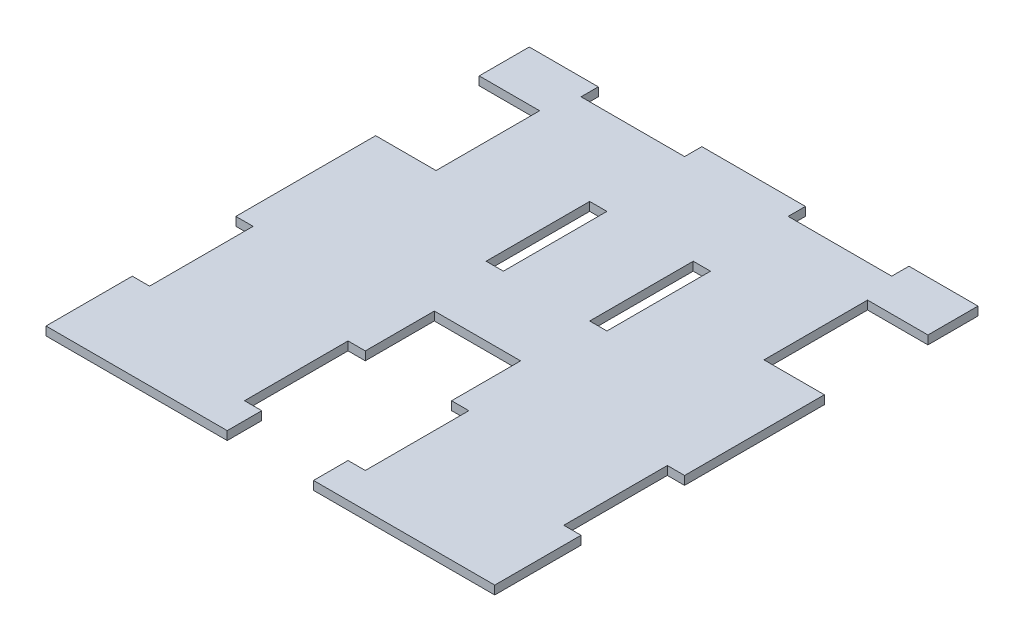
from build123d import *

# Parameters (mm, degrees)
SKETCH1_W           = 330.2
SKETCH1_H           = 355.6
BOSS_EXTRUDE1_DEPTH = 6.35
SKETCH2_W           = 63.5
SKETCH2_H           = 152.4
CUT_EXTRUDE1_DEPTH  = 243.716238641
SKETCH3_W           = 44.45
SKETCH3_H           = 76.2
CUT_EXTRUDE2_DEPTH  = 243.716238641
SKETCH4_W           = 12.7
SKETCH4_H           = 76.2
SKETCH4_W_2         = 76.2
SKETCH4_H_2         = 12.7
CUT_EXTRUDE3_DEPTH  = 243.716238641


with BuildPart() as part:
    # Sketch1 → Boss-Extrude1 (new body)
    with BuildSketch(Plane(origin=(0, 0, 0), x_dir=(1, 0, 0), z_dir=(0, 1, 0))):
        Rectangle(SKETCH1_W, SKETCH1_H)
    extrude(amount=BOSS_EXTRUDE1_DEPTH)

    # Sketch2 → Cut-Extrude1 (cut, through all)
    with BuildSketch(Plane(origin=(0, 6.35, 0), x_dir=(1, 0, 0), z_dir=(0, 1, 0))):
        with Locations((0, -101.6)):
            Rectangle(SKETCH2_W, SKETCH2_H)
    extrude(amount=-CUT_EXTRUDE1_DEPTH, mode=Mode.SUBTRACT)

    # Sketch3 → Cut-Extrude2 (cut, through all)
    with BuildSketch(Plane(origin=(0, 6.35, 0), x_dir=(1, 0, 0), z_dir=(0, 1, 0))):
        with Locations((142.875, 102.87)):
            Rectangle(SKETCH3_W, SKETCH3_H)
        with Locations((-142.875, 102.87)):
            Rectangle(SKETCH3_W, SKETCH3_H)
    extrude(amount=-CUT_EXTRUDE2_DEPTH, mode=Mode.SUBTRACT)

    # Sketch4 → Cut-Extrude3 (cut, through all)
    with BuildSketch(Plane(origin=(0, 6.35, 0), x_dir=(1, 0, 0), z_dir=(0, 1, 0))):
        with Locations((-158.75, 102.87)):
            Rectangle(SKETCH4_W, SKETCH4_H)
        with Locations((-158.75, -76.2)):
            Rectangle(SKETCH4_W, SKETCH4_H)
        with Locations((158.75, 102.87)):
            Rectangle(SKETCH4_W, SKETCH4_H)
        with Locations((158.75, -76.2)):
            Rectangle(SKETCH4_W, SKETCH4_H)
        with Locations((76.2, 171.45)):
            Rectangle(SKETCH4_W_2, SKETCH4_H_2)
        with Locations((-76.2, 171.45)):
            Rectangle(SKETCH4_W_2, SKETCH4_H_2)
        with Locations((-38.1, -114.3)):
            Rectangle(SKETCH4_W, SKETCH4_H)
        with Locations((38.1, 63.5)):
            Rectangle(SKETCH4_W, SKETCH4_H)
        with Locations((-38.1, 63.5)):
            Rectangle(SKETCH4_W, SKETCH4_H)
        with Locations((38.1, -114.3)):
            Rectangle(SKETCH4_W, SKETCH4_H)
    extrude(amount=-CUT_EXTRUDE3_DEPTH, mode=Mode.SUBTRACT)


solid = part.part
